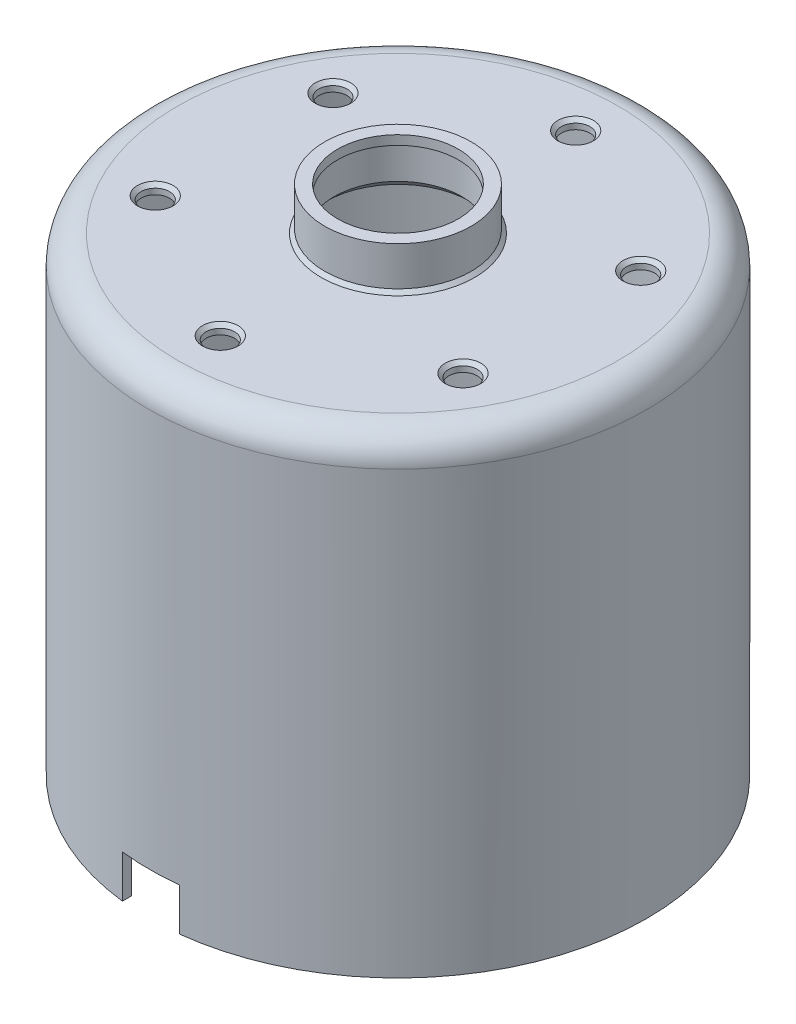
from build123d import *

# Parameters (mm, degrees)
SKETCH1_R                    = 17.5
BOSS_EXTRUDE1_DEPTH          = 33
FILLET1_R                    = 2
SKETCH3_R                    = 5.15
BOSS_EXTRUDE2_DEPTH          = 3
CHAMFER1_SIZE                = 0.25
SHELL1_T                     = -0.65
CUT_EXTRUDE1_REACH           = 45.686
SKETCH4_R                    = 4.25
CUT_EXTRUDE2_REACH           = 43.249
SKETCH5_R                    = 1
CHAMFER2_SIZE                = 0.25
CIRPATTERN1_COUNT            = 6
CHAMFER2_OF_CIRPATTERN1_SIZE = 0.25
CUT_EXTRUDE3_REACH           = 55.172
SKETCH6_W                    = 4
SKETCH6_H                    = 6


with BuildPart() as part:
    # Sketch1 → Boss-Extrude1 (new body)
    with BuildSketch(Plane(origin=(0, 0, 0), x_dir=(1, 0, 0), z_dir=(0, 1, 0))):
        Circle(SKETCH1_R)
    extrude(amount=BOSS_EXTRUDE1_DEPTH)

    # Fillet1
    fillet1_edges = [part.edges().sort_by_distance(p)[0] for p in [
        (-17.5, 33, 0),
    ]]
    fillet(fillet1_edges, radius=FILLET1_R)

    # Sketch3 → Boss-Extrude2 (add)
    with BuildSketch(Plane(origin=(0, 33, 0), x_dir=(1, 0, 0), z_dir=(0, 1, 0))):
        Circle(SKETCH3_R)
    extrude(amount=BOSS_EXTRUDE2_DEPTH)

    # Chamfer1
    chamfer1_edges = [part.edges().sort_by_distance(p)[0] for p in [
        (-5.15, 33, 0),
    ]]
    chamfer(chamfer1_edges, length=CHAMFER1_SIZE)

    # Shell1
    shell1_openings = [part.faces().sort_by_distance(p)[0] for p in [
        (0, 0, 0),
    ]]
    offset(amount=SHELL1_T, openings=shell1_openings, kind=Kind.INTERSECTION)

    # Sketch4 → Cut-Extrude1 (cut, up to next)
    with BuildSketch(Plane(origin=(0, 36, 0), x_dir=(1, 0, 0), z_dir=(0, 1, 0)), mode=Mode.PRIVATE) as cut_extrude1_sk1:
        Circle(SKETCH4_R)
    cut_extrude1_tool1 = extrude(cut_extrude1_sk1.sketch, amount=-CUT_EXTRUDE1_REACH, mode=Mode.PRIVATE) & part.part
    add(cut_extrude1_tool1.solids().sort_by_distance((0, 36, 0))[0], mode=Mode.SUBTRACT)

    # Sketch5 → Cut-Extrude2 (cut, up to next)
    with BuildSketch(Plane(origin=(0, 33, 0), x_dir=(1, 0, 0), z_dir=(0, 1, 0)), mode=Mode.PRIVATE) as cut_extrude2_sk1:
        with Locations((0, 12.5)):
            Circle(SKETCH5_R)
    cut_extrude2_tool1 = extrude(cut_extrude2_sk1.sketch, amount=-CUT_EXTRUDE2_REACH, mode=Mode.PRIVATE) & part.part
    cut_extrude2 = cut_extrude2_tool1.solids().sort_by_distance((0, 33, -12.5))[0]
    add(cut_extrude2, mode=Mode.SUBTRACT)

    # Chamfer2
    chamfer2_edges = [part.edges().sort_by_distance(p)[0] for p in [
        (-1, 33, -12.5),
    ]]
    chamfer(chamfer2_edges, length=CHAMFER2_SIZE)

    # CirPattern1: Cut-Extrude2 ×6 about axis
    cirpattern1_axis = Axis((0, 36, 0), (0, 1, 0))
    for i in range(1, CIRPATTERN1_COUNT):
        add(cut_extrude2.rotate(cirpattern1_axis, i * 360 / CIRPATTERN1_COUNT), mode=Mode.SUBTRACT)

    # Chamfer2 of CirPattern1
    chamfer2_of_cirpattern1_edges = [part.edges().sort_by_distance(p)[0] for p in [
        (-11.325317547, 33, -5.383974596),
        (-10.325317547, 33, 7.116025404),
        (1, 33, 12.5),
        (11.325317547, 33, 5.383974596),
        (10.325317547, 33, -7.116025404),
    ]]
    chamfer(chamfer2_of_cirpattern1_edges, length=CHAMFER2_OF_CIRPATTERN1_SIZE)

    # Sketch6 → Cut-Extrude3 (cut, up to next)
    with BuildSketch(Plane.XY.offset(17.5), mode=Mode.PRIVATE) as cut_extrude3_sk1:
        Rectangle(SKETCH6_W, SKETCH6_H)
    cut_extrude3_tool1 = extrude(cut_extrude3_sk1.sketch, amount=-CUT_EXTRUDE3_REACH, mode=Mode.PRIVATE) & part.part
    add(cut_extrude3_tool1.solids().sort_by_distance((0, 0, 17.5))[0], mode=Mode.SUBTRACT)


solid = part.part
